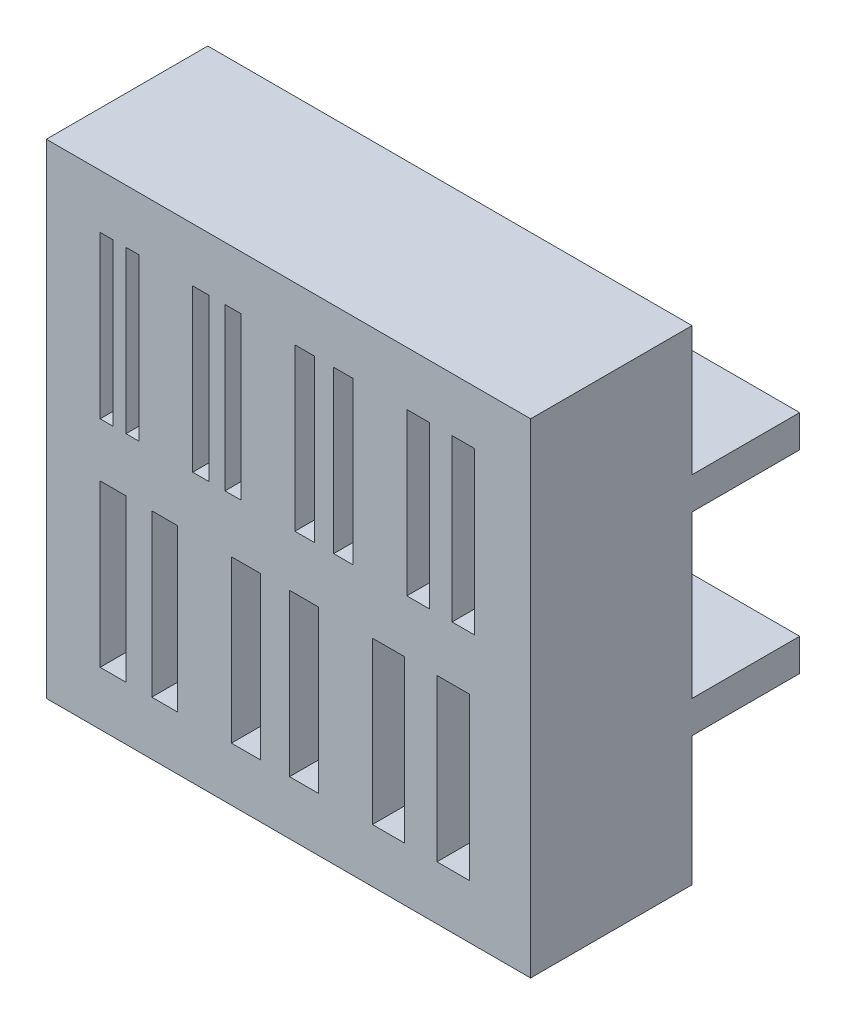
from build123d import *

# Parameters (mm, degrees)
BASE_W            = 45
BASE_H            = 45
BLOCK_DEPTH       = 15
SKETCH5_W         = 1.2
SKETCH5_H         = 15
ROW_1_SEED_DEPTH  = 66.383484153
ROW_1_START       = 25
ROW_1_OUTLINE_W   = 2.1
ROW_1_OUTLINE_H   = 15
ROW_1_OUTLINE_W_2 = 1.8
ROW_1_OUTLINE_W_3 = 1.5
ROW_1_DEPTH       = 15
SKETCH6_W         = 2.4
SKETCH6_H         = 15
ROW_2_SEED_DEPTH  = 66.383484153
ROW_2_START       = 5
ROW_2_OUTLINE_W   = 3
ROW_2_OUTLINE_H   = 15
ROW_2_OUTLINE_W_2 = 2.7
ROW_2_DEPTH       = 15
SKETCH8_W         = 45
SKETCH8_H         = 3
ADAPTER_DEPTH     = 10


# Read off the part's stored shape, not the designer's step: row-1, row-2
with BuildPart() as part:
    # base → block (new body)
    with BuildSketch(Plane.XY):
        with Locations((22.5, 22.5)):
            Rectangle(BASE_W, BASE_H)
    extrude(amount=BLOCK_DEPTH)

    # Sketch5 → row-1-seed (cut, through all)
    with BuildSketch(Plane.XY.offset(15)):
        with Locations((5.6, 32.5)):
            Rectangle(SKETCH5_W, SKETCH5_H)
        with Locations((8, 32.5)):
            Rectangle(SKETCH5_W, SKETCH5_H)
    extrude(amount=-ROW_1_SEED_DEPTH, mode=Mode.SUBTRACT)

    # row-1 outline → row-1 (cut)
    with BuildSketch(Plane(origin=(0, 0, 0), x_dir=(1, 0, 0), z_dir=(0, 1, 0)).offset(ROW_1_START)):
        with Locations((38.75, -7.5)):
            Rectangle(ROW_1_OUTLINE_W, ROW_1_OUTLINE_H)
        with Locations((34.55, -7.5)):
            Rectangle(ROW_1_OUTLINE_W, ROW_1_OUTLINE_H)
        with Locations((27.6, -7.5)):
            Rectangle(ROW_1_OUTLINE_W_2, ROW_1_OUTLINE_H)
        with Locations((24, -7.5)):
            Rectangle(ROW_1_OUTLINE_W_2, ROW_1_OUTLINE_H)
        with Locations((17.35, -7.5)):
            Rectangle(ROW_1_OUTLINE_W_3, ROW_1_OUTLINE_H)
        with Locations((14.35, -7.5)):
            Rectangle(ROW_1_OUTLINE_W_3, ROW_1_OUTLINE_H)
    extrude(amount=ROW_1_DEPTH, mode=Mode.SUBTRACT)

    # Sketch6 → row-2-seed (cut, through all)
    with BuildSketch(Plane.XY.offset(15)):
        with Locations((6.2, 12.5)):
            Rectangle(SKETCH6_W, SKETCH6_H)
        with Locations((11, 12.5)):
            Rectangle(SKETCH6_W, SKETCH6_H)
    extrude(amount=-ROW_2_SEED_DEPTH, mode=Mode.SUBTRACT)

    # row-2 outline → row-2 (cut)
    with BuildSketch(Plane(origin=(0, 0, 0), x_dir=(1, 0, 0), z_dir=(0, 1, 0)).offset(ROW_2_START)):
        with Locations((37.8, -7.5)):
            Rectangle(ROW_2_OUTLINE_W, ROW_2_OUTLINE_H)
        with Locations((31.8, -7.5)):
            Rectangle(ROW_2_OUTLINE_W, ROW_2_OUTLINE_H)
        with Locations((23.95, -7.5)):
            Rectangle(ROW_2_OUTLINE_W_2, ROW_2_OUTLINE_H)
        with Locations((18.55, -7.5)):
            Rectangle(ROW_2_OUTLINE_W_2, ROW_2_OUTLINE_H)
    extrude(amount=ROW_2_DEPTH, mode=Mode.SUBTRACT)

    # Sketch8 → adapter (add)
    with BuildSketch(Plane(origin=(0, 0, 0), x_dir=(-1, 0, 0), z_dir=(0, 0, -1))):
        with Locations((-22.5, 31.5)):
            Rectangle(SKETCH8_W, SKETCH8_H)
        with Locations((-22.5, 13.5)):
            Rectangle(SKETCH8_W, SKETCH8_H)
    extrude(amount=ADAPTER_DEPTH)


solid = part.part
